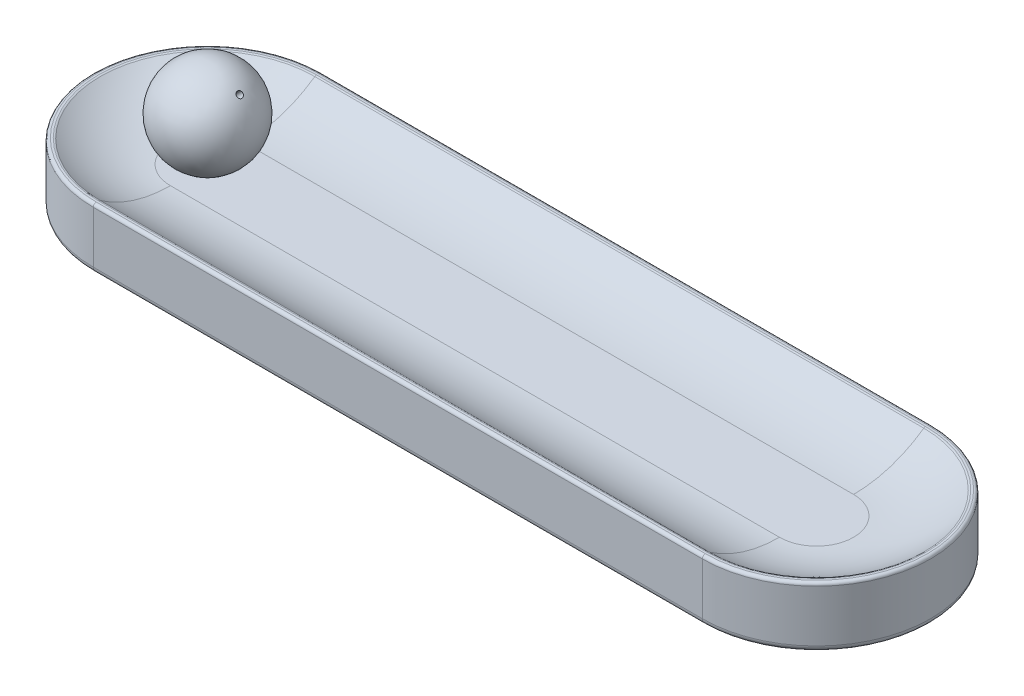
from build123d import *

# Parameters (mm, degrees)
BOSS_EXTRUDE1_DEPTH = 20
CUT_EXTRUDE1_DEPTH  = 7.5
FILLET1_R           = 40
FILLET2_R           = 1
FILLET3_R           = 2
SKETCH6_R           = 1
CUT_EXTRUDE2_DEPTH  = 15


with BuildPart() as part:
    # Sketch1 → Boss-Extrude1 (new body)
    with BuildSketch(Plane(origin=(0, 0, 0), x_dir=(1, 0, 0), z_dir=(0, 1, 0))):
        with BuildLine():
            Line((-100, 37.5), (100, 37.5))
            ThreePointArc((100, 37.5), (137.5, 0), (100, -37.5))
            Line((100, -37.5), (-100, -37.5))
            ThreePointArc((-100, -37.5), (-137.5, 0), (-100, 37.5))
        make_face()
    extrude(amount=BOSS_EXTRUDE1_DEPTH)

    # Sketch2 → Cut-Extrude1 (cut)
    with BuildSketch(Plane(origin=(0, 20, 0), x_dir=(1, 0, 0), z_dir=(0, 1, 0))):
        with BuildLine():
            Line((-100, -35.5), (100, -35.5))
            ThreePointArc((100, -35.5), (135.5, 0), (100, 35.5))
            Line((100, 35.5), (-100, 35.5))
            ThreePointArc((-100, 35.5), (-135.5, 0), (-100, -35.5))
        make_face()
    extrude(amount=-CUT_EXTRUDE1_DEPTH, mode=Mode.SUBTRACT)

    # Fillet1
    # the kernel refuses this fillet: 40 mm, written as the material it adds along each edge
    with BuildSketch(Plane(origin=(100, 12.5, -35.5), x_dir=(0, 1, 0), z_dir=(-1, 0, 0)), Plane(origin=(-100, 12.5, 35.5), x_dir=(0, 1, 0), z_dir=(1, 0, 0))) as fillet1_piece_1:
        with BuildLine():
            CenterArc((40, -23.318447633), FILLET1_R, 144.340912304, 35.659087696)
            Line((0, -23.318447633), (-0.8, -23.318447633))
            Line((-0.8, -23.318447633), (-0.8, 0))
            Line((-0.8, 0), (0, 0.8))
            ThreePointArc((0, 0.8), (3.75, 0.8), (6.85, 0.466368953))
            Line((6.85, 0.466368953), (7.5, 0))
        make_face()
    extrude(amount=200)
    with BuildSketch(Plane(origin=(-100, 12.5, 0), x_dir=(0, 0, -1), z_dir=(1, 0, 0))) as fillet1_piece_2:
        with BuildLine():
            CenterArc((12.181552367, 40), FILLET1_R, 270, 35.659087696)
            Line((12.181552367, 0), (12.181552367, -0.8))
            Line((12.181552367, -0.8), (35.5, -0.8))
            Line((35.5, -0.8), (36.3, 0))
            ThreePointArc((36.3, 0), (36.3, 3.75), (35.966368953, 6.85))
            Line((35.966368953, 6.85), (35.5, 7.5))
        make_face()
    revolve(axis=Axis((-100, 12.5, 0), (0, 1, 0)), revolution_arc=180)
    with BuildSketch(Plane(origin=(100, 12.5, 0), x_dir=(0, 0, 1), z_dir=(-1, 0, 0))) as fillet1_piece_3:
        with BuildLine():
            CenterArc((12.181552367, 40), FILLET1_R, 270, 35.659087696)
            Line((12.181552367, 0), (12.181552367, -0.8))
            Line((12.181552367, -0.8), (35.5, -0.8))
            Line((35.5, -0.8), (36.3, 0))
            ThreePointArc((36.3, 0), (36.3, 3.75), (35.966368953, 6.85))
            Line((35.966368953, 6.85), (35.5, 7.5))
        make_face()
    revolve(axis=Axis((100, 12.5, 0), (0, 1, 0)), revolution_arc=180)

    # Fillet2
    fillet2_edges = [part.edges().sort_by_distance(p)[0] for p in [
        (137.5, 20, 0),
        (0, 20, -37.5),
        (-135.5, 20, 0),
        (0, 20, 35.5),
        (135.5, 20, 0),
        (0, 20, -35.5),
        (-137.5, 20, 0),
        (0, 20, 37.5),
    ]]
    fillet(fillet2_edges, radius=FILLET2_R)

    # Fillet3
    fillet3_edges = [part.edges().sort_by_distance(p)[0] for p in [
        (0, 0, -37.5),
        (137.5, 0, 0),
        (0, 0, 37.5),
        (-137.5, 0, 0),
    ]]
    fillet(fillet3_edges, radius=FILLET3_R)

    # Sketch4 → Revolve1 (revolve)
    with BuildSketch(Plane.XY):
        with BuildLine():
            Line((-100, 12), (-100, 42))
            ThreePointArc((-100, 42), (-115, 27), (-100, 12))
        make_face()
    revolve(axis=Axis((-100, 12, 0), (0, 1, 0)))

    # Sketch6 → Cut-Extrude2 (cut)
    with BuildSketch(Plane(origin=(-25.893398282, -25.893398282, 0), x_dir=(0.7071067811865488, -0.7071067811865464, 0), z_dir=(0.7071067811865464, 0.7071067811865488, 0))):
        with Locations(Location((-89.802561211, 0, 0), (0, 0, 180))):
            Circle(SKETCH6_R)
    extrude(amount=-CUT_EXTRUDE2_DEPTH, mode=Mode.SUBTRACT)


solid = part.part
